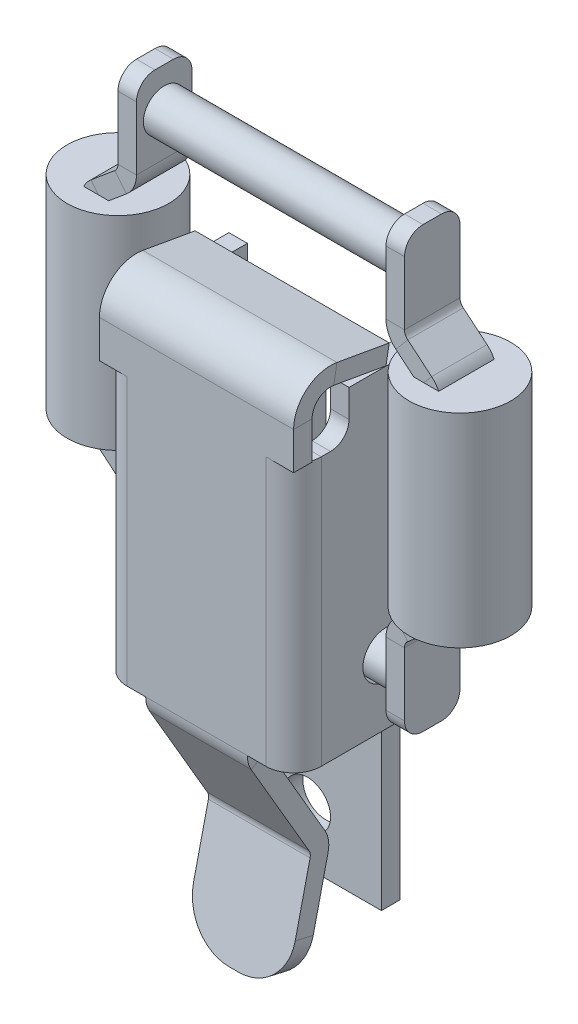
from build123d import *

# Parameters (mm, degrees)
T_LE_DE_BASE_PLI_E1_DEPTH               = 8
ESQUISSE6_R                             = 2.5
ENL_V_MAT_EXTRU_1_DEPTH                 = 2
T_LE_DE_BASE_PLI_E2_DEPTH               = 10.5
ESQUISSE10_W                            = 5
ESQUISSE10_H                            = 25.270349141
ENL_V_MAT_EXTRU_2_DEPTH                 = 44.660622991
T_LE_PLI_E_SUR_AR_TE1_STRIP_W           = 10
T_LE_PLI_E_SUR_AR_TE1_STRIP_H           = 2
T_LE_PLI_E_SUR_AR_TE1_STRIP_CUT_DEPTH   = 29
T_LE_PLI_E_SUR_AR_TE1_STRIP_2_W         = 10
T_LE_PLI_E_SUR_AR_TE1_STRIP_2_H         = 2
T_LE_PLI_E_SUR_AR_TE1_STRIP_CUT_2_DEPTH = 29
T_LE_PLI_E_SUR_AR_TE1_DEPTH             = 29
T_LE_PLI_E_SUR_AR_TE1_FLAT_DEPTH        = 2
T_LE_PLI_E_SUR_AR_TE1_BEND_DEPTH        = 29
T_LE_PLI_E_SUR_AR_TE1_FLAT_2_DEPTH      = 2
CONG_1_R                                = 5
ESQUISSE17_R                            = 2.5
ENL_V_MAT_EXTRU_3_DEPTH                 = 48.296934362
ESQUISSE18_R                            = 2.25
BOSS_EXTRU_1_DEPTH                      = 13.5
BOSS_EXTRU_1_2_DEPTH                    = 13.5
T_LE_DE_BASE_PLI_E3_DEPTH               = 6
CONG_2_R                                = 2
BOSS_EXTRU_2_START                      = 0.75
ESQUISSE24_R                            = 5.5
BOSS_EXTRU_2_DEPTH                      = 22


# Sheet-metal steps are written as plain solids
with BuildPart() as part:
    # Esquisse1 → Tôle de base pliée1 (new, symmetric)
    with BuildSketch(Plane(origin=(0, 0, 0), x_dir=(0, 0, -1), z_dir=(1, 0, 0))):
        with BuildLine():
            Line((0, -34), (0, 3.601077026))
            ThreePointArc((0, 3.601077026), (-0.281076639, 4.868931811), (-1.071637171, 5.899210355))
            Line((-1.071637171, 5.899210355), (-7.64278761, 11.413060264))
            ThreePointArc((-7.64278761, 11.413060264), (-7.906307787, 11.756486446), (-8, 12.179104708))
            Line((-8, 12.179104708), (-8, 20))
            Line((-8, 20), (-10, 20))
            Line((-10, 20), (-10, 12.179104708))
            ThreePointArc((-10, 12.179104708), (-9.718923361, 10.911249922), (-8.928362829, 9.880971378))
            Line((-8.928362829, 9.880971378), (-2.35721239, 4.367121469))
            ThreePointArc((-2.35721239, 4.367121469), (-2.093692213, 4.023695287), (-2, 3.601077026))
            Line((-2, 3.601077026), (-2, -34))
            Line((-2, -34), (0, -34))
        make_face()
    extrude(amount=T_LE_DE_BASE_PLI_E1_DEPTH, both=True)

    # Esquisse6 → Enlèv. mat.-Extru.1 (cut)
    with BuildSketch(Plane.XY.offset(2)):
        Circle(ESQUISSE6_R)
        with Locations((0, -28)):
            Circle(ESQUISSE6_R)
    extrude(amount=-ENL_V_MAT_EXTRU_1_DEPTH, mode=Mode.SUBTRACT)


with BuildPart() as body_2:
    # Esquisse7 → Tôle de base pliée2 (new, symmetric)
    with BuildSketch(Plane(origin=(0, 0, 0), x_dir=(0, 0, -1), z_dir=(1, 0, 0))):
        with BuildLine():
            Line((-4, 19.294692077), (-9.652703645, 20.291416244))
            ThreePointArc((-9.652703645, 20.291416244), (-11.285575219, 19.853889624), (-12, 18.321800738))
            Line((-12, 18.321800738), (-12, -14.729650859))
            ThreePointArc((-12, -14.729650859), (-11.965344213, -14.990630838), (-11.863778901, -15.233521884))
            Line((-11.863778901, -15.233521884), (-5.599269134, -25.972681485))
            ThreePointArc((-5.599269134, -25.972681485), (-5.224579141, -27.03408834), (-5.26743225, -28.158873081))
            Line((-5.26743225, -28.158873081), (-8, -40))
            Line((-8, -40), (-9.948782391, -39.550280987))
            Line((-9.948782391, -39.550280987), (-7.216214641, -27.709154068))
            ThreePointArc((-7.216214641, -27.709154068), (-7.201930271, -27.334225821), (-7.326826936, -26.980423536))
            Line((-7.326826936, -26.980423536), (-13.591336703, -16.241263935))
            ThreePointArc((-13.591336703, -16.241263935), (-13.89603264, -15.512590796), (-14, -14.729650859))
            Line((-14, -14.729650859), (-14, 18.321800738))
            ThreePointArc((-14, 18.321800738), (-12.571150439, 21.38597851), (-9.305407289, 22.26103175))
            Line((-9.305407289, 22.26103175), (-3.652703645, 21.264307583))
            Line((-3.652703645, 21.264307583), (-4, 19.294692077))
        make_face()
    extrude(amount=T_LE_DE_BASE_PLI_E2_DEPTH, both=True)

    # Esquisse10 → Enlèv. mat.-Extru.2 (cut, through all)
    with BuildSketch(Plane.XY.offset(14)):
        with Locations((-8, -27.36482543)):
            Rectangle(ESQUISSE10_W, ESQUISSE10_H)
        with Locations((8, -27.36482543)):
            Rectangle(ESQUISSE10_W, ESQUISSE10_H)
    extrude(amount=-ENL_V_MAT_EXTRU_2_DEPTH, mode=Mode.SUBTRACT)

    # Tôle pliée sur arête1 strip (across the edge) → Tôle pliée sur arête1 strip cut (cut)
    with BuildSketch(Plane(origin=(10.5, 14.270349141, 12), x_dir=(-1, 0, 0), z_dir=(0, -1, 0))):
        with Locations((-2, -1)):
            Rectangle(T_LE_PLI_E_SUR_AR_TE1_STRIP_W, T_LE_PLI_E_SUR_AR_TE1_STRIP_H)
    extrude(amount=T_LE_PLI_E_SUR_AR_TE1_STRIP_CUT_DEPTH, mode=Mode.SUBTRACT)

    # Tôle pliée sur arête1 strip 2 (across the edge) → Tôle pliée sur arête1 strip cut 2 (cut)
    with BuildSketch(Plane(origin=(-10.5, -14.729650859, 12), x_dir=(1, 0, 0), z_dir=(0, 1, 0))):
        with Locations((-2, -1)):
            Rectangle(T_LE_PLI_E_SUR_AR_TE1_STRIP_2_W, T_LE_PLI_E_SUR_AR_TE1_STRIP_2_H)
    extrude(amount=T_LE_PLI_E_SUR_AR_TE1_STRIP_CUT_2_DEPTH, mode=Mode.SUBTRACT)

    # Tôle pliée sur arête1 bend section (across the edge) → Tôle pliée sur arête1 (add)
    with BuildSketch(Plane(origin=(10.5, 14.270349141, 12), x_dir=(-1, 0, 0), z_dir=(0, -1, 0))):
        with BuildLine():
            Line((0, 1), (2, 1))
            ThreePointArc((2, 1), (2.292893219, 0.292893219), (3, 0))
            Line((3, 0), (3, -2))
            ThreePointArc((3, -2), (0.878679656, -1.121320344), (0, 1))
        make_face()
    extrude(amount=T_LE_PLI_E_SUR_AR_TE1_DEPTH)

    # Tôle pliée sur arête1 profile (on flange) → Tôle pliée sur arête1 flat (add)
    with BuildSketch(Plane(origin=(10.5, 0, 12), x_dir=(0, 1, 0), z_dir=(-1, 0, 0))):
        with BuildLine():
            ThreePointArc((14.270349141, 2), (14.856135579, 3.414213562), (16.270349141, 4))
            Line((16.270349141, 4), (19.270349141, 4))
            Line((19.270349141, 4), (19.270349141, 12))
            Line((19.270349141, 12), (-14.729650859, 12))
            Line((-14.729650859, 12), (-14.729650859, 1))
            Line((-14.729650859, 1), (14.270349141, 1))
            Line((14.270349141, 1), (14.270349141, 2))
        make_face()
    extrude(amount=T_LE_PLI_E_SUR_AR_TE1_FLAT_DEPTH)

    # Tôle pliée sur arête1 bend section 2 (across the edge) → Tôle pliée sur arête1 bend (add)
    with BuildSketch(Plane(origin=(-10.5, -14.729650859, 12), x_dir=(1, 0, 0), z_dir=(0, 1, 0))):
        with BuildLine():
            Line((0, 1), (2, 1))
            ThreePointArc((2, 1), (2.292893219, 0.292893219), (3, 0))
            Line((3, 0), (3, -2))
            ThreePointArc((3, -2), (0.878679656, -1.121320344), (0, 1))
        make_face()
    extrude(amount=T_LE_PLI_E_SUR_AR_TE1_BEND_DEPTH)

    # Tôle pliée sur arête1 profile 2 (on flange) → Tôle pliée sur arête1 flat 2 (add)
    with BuildSketch(Plane(origin=(-10.5, 0, 12), x_dir=(0, -1, 0), z_dir=(1, 0, 0))):
        with BuildLine():
            ThreePointArc((-16.270349141, 4), (-14.856135579, 3.414213562), (-14.270349141, 2))
            Line((-14.270349141, 2), (-14.270349141, 1))
            Line((-14.270349141, 1), (14.729650859, 1))
            Line((14.729650859, 1), (14.729650859, 12))
            Line((14.729650859, 12), (-19.270349141, 12))
            Line((-19.270349141, 12), (-19.270349141, 4))
            Line((-19.270349141, 4), (-16.270349141, 4))
        make_face()
    extrude(amount=T_LE_PLI_E_SUR_AR_TE1_FLAT_2_DEPTH)

    # Congé1
    cong_1_edges = [body_2.edges().sort_by_distance(p)[0] for p in [
        (-5.5, -39.775140493, 8.974391196),
        (5.5, -39.775140493, 8.974391196),
    ]]
    fillet(cong_1_edges, radius=CONG_1_R)

    # Esquisse17 → Enlèv. mat.-Extru.3 (cut, through all)
    with BuildSketch(Plane(origin=(10.5, 0, 0), x_dir=(0, 0, -1), z_dir=(1, 0, 0))):
        with Locations((-4, -7.729650859)):
            Circle(ESQUISSE17_R)
    extrude(amount=-ENL_V_MAT_EXTRU_3_DEPTH, mode=Mode.SUBTRACT)


with BuildPart() as body_3:
    # Esquisse18 → Boss.-Extru.1 (new, symmetric)
    with BuildSketch(Plane(origin=(0, 0, 0), x_dir=(0, 0, -1), z_dir=(1, 0, 0))):
        with Locations((-4, -7.729650859)):
            Circle(ESQUISSE18_R)
    extrude(amount=BOSS_EXTRU_1_DEPTH, both=True)


with BuildPart() as body_4:
    # Esquisse18 → Boss.-Extru.1 2 (new, symmetric)
    with BuildSketch(Plane(origin=(0, 0, 0), x_dir=(0, 0, -1), z_dir=(1, 0, 0))):
        with Locations((-4, 31.270349141)):
            Circle(ESQUISSE18_R)
    extrude(amount=BOSS_EXTRU_1_2_DEPTH, both=True)


with BuildPart() as body_5:
    # Esquisse21 → Tôle de base pliée3 (new body)
    with BuildSketch(Plane.XY):
        with BuildLine():
            Line((13.5, 35.520349141), (13.5, 26.669272116))
            ThreePointArc((13.5, 26.669272116), (13.781076639, 25.401417331), (14.571637171, 24.371138786))
            Line((14.571637171, 24.371138786), (17.14278761, 22.213687402))
            ThreePointArc((17.14278761, 22.213687402), (17.406307787, 21.87026122), (17.5, 21.447642958))
            Line((17.5, 21.447642958), (17.5, 2.093055324))
            ThreePointArc((17.5, 2.093055324), (17.406307787, 1.670437062), (17.14278761, 1.327010881))
            Line((17.14278761, 1.327010881), (14.571637171, -0.830440504))
            ThreePointArc((14.571637171, -0.830440504), (13.781076639, -1.860719048), (13.5, -3.128573833))
            Line((13.5, -3.128573833), (13.5, -11.979650859))
            Line((13.5, -11.979650859), (15.5, -11.979650859))
            Line((15.5, -11.979650859), (15.5, -3.128573833))
            ThreePointArc((15.5, -3.128573833), (15.593692213, -2.705955571), (15.85721239, -2.36252939))
            Line((15.85721239, -2.36252939), (18.428362829, -0.205078005))
            ThreePointArc((18.428362829, -0.205078005), (19.218923361, 0.825200539), (19.5, 2.093055324))
            Line((19.5, 2.093055324), (19.5, 21.447642958))
            ThreePointArc((19.5, 21.447642958), (19.218923361, 22.715497744), (18.428362829, 23.745776288))
            Line((18.428362829, 23.745776288), (15.85721239, 25.903227673))
            ThreePointArc((15.85721239, 25.903227673), (15.593692213, 26.246653854), (15.5, 26.669272116))
            Line((15.5, 26.669272116), (15.5, 35.520349141))
            Line((15.5, 35.520349141), (13.5, 35.520349141))
        make_face()
    extrude(amount=T_LE_DE_BASE_PLI_E3_DEPTH)


with BuildPart() as body_5_1:
    # Corps-Déplacer/Copier1: moved
    add(body_5.part.moved(Location((0, 0, 1))))

    # Congé2
    cong_2_edges = [body_5_1.edges().sort_by_distance(p)[0] for p in [
        (14.5, 35.520349141, 1),
        (14.5, -11.979650859, 1),
        (14.5, 35.520349141, 7),
        (14.5, -11.979650859, 7),
    ]]
    fillet(cong_2_edges, radius=CONG_2_R)


with BuildPart() as body_6:
    # Esquisse24 → Boss.-Extru.2 (new body)
    with BuildSketch(Plane(origin=(0, 0, 0), x_dir=(1, 0, 0), z_dir=(0, 1, 0)).offset(BOSS_EXTRU_2_START)):
        with Locations(Location((18.5, -4, 0), (0, 0, 270))):
            Circle(ESQUISSE24_R)
    extrude(amount=BOSS_EXTRU_2_DEPTH)


with BuildPart() as body_7:
    # Symétrie1: mirrored copy
    add(body_5_1.part.mirror(Plane(origin=(0, 0, 0), x_dir=(0, 0, 1), z_dir=(1, 0, 0))))


with BuildPart() as body_8:
    # Sym_trie1 2: mirrored copy
    add(body_6.part.mirror(Plane(origin=(0, 0, 0), x_dir=(0, 0, 1), z_dir=(1, 0, 0))))


solid = Compound([part.part, body_2.part, body_3.part, body_4.part, body_5_1.part, body_6.part, body_7.part, body_8.part])
